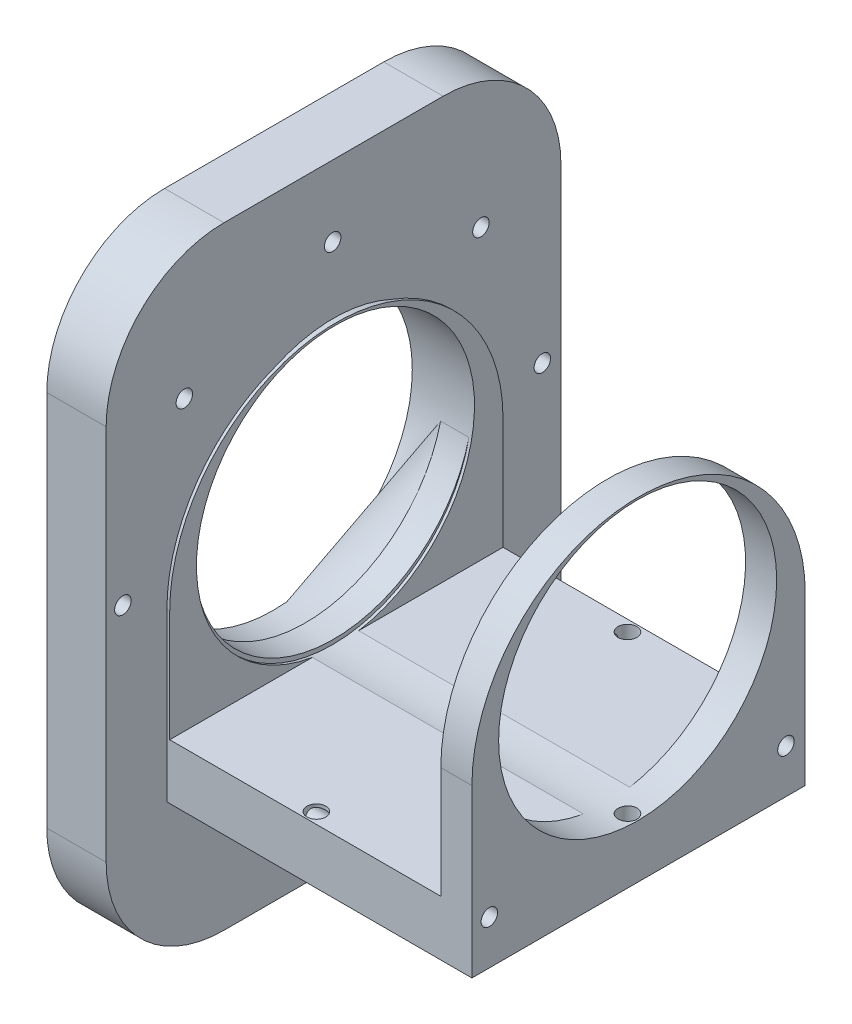
from build123d import *

# Parameters (mm, degrees)
SKETCH_1_W               = 70.72
SKETCH_1_H               = 70.72
EXTRUDE_1_DEPTH          = 70.72
CUT_EXTRUDE_2_DEPTH      = 125.72
CUT_EXTRUDE_2_DEPTH_BACK = 26
SKETCH_2_W               = 57.52
SKETCH_2_H               = 59
FILLET_1_RADIUS          = 35.36
FILLET_1_LENGTH          = 6.6
FILLET_2_RADIUS          = 35.36
FILLET_2_LENGTH          = 6.6
CUT_EXTRUDE_4_DEPTH      = 1
CUT_EXTRUDE_4_DEPTH_BACK = 267
SKETCH_3_R               = 29.5
SKETCH_8_R               = 3
EXTRUDE_2_DEPTH          = 6
SKETCH_11_R              = 1.75
CUT_EXTRUDE_5_DEPTH      = 88
SKETCH_14_W              = 96.5
SKETCH_14_H              = 130.02
EXTRUDE_3_DEPTH          = 6.6
SKETCH_21_R              = 29.5
CUT_EXTRUDE_7_DEPTH      = 51
CUT_EXTRUDE_START        = -10
SKETCH_24_R              = 1.75
CUT_EXTRUDE_8_DEPTH      = 10
EXTRUDE_4_OUTLINE_W      = 96.5
EXTRUDE_4_OUTLINE_H      = 130.02
EXTRUDE_4_DEPTH          = 6
CUT_EXTRUDE_START_2      = 32
SKETCH_27_R              = 1.75
CUT_EXTRUDE_13_DEPTH     = 32
CUT_EXTRUDE_15_REACH     = 139.206
SKETCH_29_R              = 2
FILLET_3_R               = 25
FILLET_4_R               = 25
FILLET_5_R               = 25
FILLET_6_R               = 25


# Read off the part's stored shape, not the designer's step: 凸台-拉伸4
with BuildPart() as part:
    # 草图1 → 凸台-拉伸1 (new body)
    with BuildSketch(Plane.XY):
        Rectangle(SKETCH_1_W, SKETCH_1_H)
    extrude(amount=EXTRUDE_1_DEPTH)

    # 草图2 → 切除-拉伸2 (cut, two sides: drawn at the far end of the back side and taken through both)
    with BuildSketch(Plane.XY.offset(-CUT_EXTRUDE_2_DEPTH_BACK)):
        with Locations((0, 5.86)):
            Rectangle(SKETCH_2_W, SKETCH_2_H)
    extrude(amount=CUT_EXTRUDE_2_DEPTH + CUT_EXTRUDE_2_DEPTH_BACK, mode=Mode.SUBTRACT)

    # 圆角1: full round fillet: the end face becomes a half cylinder, R = half its width
    fillet_1_face = Plane((-32.06, 35.36, 35.36), x_dir=(-1, 0, 0), z_dir=(0, 1, 0))  # on the end face: x along it, z out of the body
    fillet_1_slab = fillet_1_face.offset(-FILLET_1_RADIUS / 2) * Box(FILLET_1_LENGTH, 2 * FILLET_1_RADIUS, FILLET_1_RADIUS, mode=Mode.PRIVATE)  # the body's end, R deep
    fillet_1_round = Plane((-32.06, 0, 35.36), x_dir=(0, 1, 0), z_dir=(-1, 0, 0)) * Cylinder(FILLET_1_RADIUS, FILLET_1_LENGTH, mode=Mode.PRIVATE)  # its axis R under the face
    add(fillet_1_slab - fillet_1_round, mode=Mode.SUBTRACT)

    # 圆角2: full round fillet: the end face becomes a half cylinder, R = half its width
    fillet_2_face = Plane((32.06, 35.36, 35.36), x_dir=(-1, 0, 0), z_dir=(0, 1, 0))  # on the end face: x along it, z out of the body
    fillet_2_slab = fillet_2_face.offset(-FILLET_2_RADIUS / 2) * Box(FILLET_2_LENGTH, 2 * FILLET_2_RADIUS, FILLET_2_RADIUS, mode=Mode.PRIVATE)  # the body's end, R deep
    fillet_2_round = Plane((32.06, 0, 35.36), x_dir=(0, 1, 0), z_dir=(-1, 0, 0)) * Cylinder(FILLET_2_RADIUS, FILLET_2_LENGTH, mode=Mode.PRIVATE)  # its axis R under the face
    add(fillet_2_slab - fillet_2_round, mode=Mode.SUBTRACT)

    # 草图3 → 切除-拉伸4 (cut, two sides: drawn at the far end of the back side and taken through both)
    with BuildSketch(Plane(origin=(35.36, 0, 0), x_dir=(0, 0, -1), z_dir=(1, 0, 0)).offset(-CUT_EXTRUDE_4_DEPTH_BACK)):
        with Locations(Location((-35.555066, 5.448484, 0), (0, 0, 90))):
            Circle(SKETCH_3_R)
    extrude(amount=CUT_EXTRUDE_4_DEPTH + CUT_EXTRUDE_4_DEPTH_BACK, mode=Mode.SUBTRACT)

    # 草图8 → 凸台-拉伸2 (add)
    with BuildSketch(Plane.XZ.offset(35.36)):
        with Locations(Location((0, 35.36, 0), (0, 0, 90))):
            Circle(SKETCH_8_R)
    extrude(amount=EXTRUDE_2_DEPTH)

    # 草图11 → 切除-拉伸5 (cut)
    with BuildSketch(Plane(origin=(35.36, 0, 0), x_dir=(0, 0, -1), z_dir=(1, 0, 0))):
        with Locations((-35.555066, -39.051516)):
            Circle(SKETCH_11_R)
        with Locations((-67.021318, -26.017768)):
            Circle(SKETCH_11_R)
        with Locations((-80.055066, 5.448484)):
            Circle(SKETCH_11_R)
        with Locations((-67.021318, 36.914736)):
            Circle(SKETCH_11_R)
        with Locations((-35.555066, 49.948484)):
            Circle(SKETCH_11_R)
        with Locations((-4.088814, 36.914736)):
            Circle(SKETCH_11_R)
        with Locations((8.944934, 5.448484)):
            Circle(SKETCH_11_R)
        with Locations((-4.088814, -26.017768)):
            Circle(SKETCH_11_R)
    extrude(amount=-CUT_EXTRUDE_5_DEPTH, mode=Mode.SUBTRACT)

    # 草图14 → 凸台-拉伸3 (add)
    with BuildSketch(Plane.ZY.offset(35.36)):
        with Locations((35.36, 0)):
            Rectangle(SKETCH_14_W, SKETCH_14_H)
    extrude(amount=EXTRUDE_3_DEPTH)

    # 草图21 → 切除-拉伸7 (cut)
    with BuildSketch(Plane(origin=(-35.36, 0, 0), x_dir=(0, 0, -1), z_dir=(1, 0, 0))):
        with Locations(Location((-35.555066, 5.448484, 0), (0, 0, 270))):
            Circle(SKETCH_21_R)
    extrude(amount=-CUT_EXTRUDE_7_DEPTH, mode=Mode.SUBTRACT)

    # 草图24 → 切除-拉伸8 (cut)
    with BuildSketch(Plane.ZY.offset(41.96).offset(CUT_EXTRUDE_START)):
        with Locations(Location((35.555066, 49.948484, 0), (0, 0, 270))):
            Circle(SKETCH_24_R)
        with Locations(Location((67.021318, 36.914736, 0), (0, 0, 270))):
            Circle(SKETCH_24_R)
        with Locations(Location((80.055066, 5.448484, 0), (0, 0, 270))):
            Circle(SKETCH_24_R)
        with Locations(Location((67.021318, -26.017768, 0), (0, 0, 180))):
            Circle(SKETCH_24_R)
        with Locations(Location((35.555066, -39.051516, 0), (0, 0, 180))):
            Circle(SKETCH_24_R)
        with Locations(Location((4.088814, -26.017768, 0), (0, 0, 180))):
            Circle(SKETCH_24_R)
        with Locations(Location((-8.944934, 5.448484, 0), (0, 0, 270))):
            Circle(SKETCH_24_R)
        with Locations(Location((4.088814, 36.914736, 0), (0, 0, 270))):
            Circle(SKETCH_24_R)
    extrude(amount=CUT_EXTRUDE_8_DEPTH, mode=Mode.SUBTRACT)

    # 凸台-拉伸4 outline → 凸台-拉伸4 (add)
    with BuildSketch(Plane(origin=(-35.36, 0, 0), x_dir=(0, 0, -1), z_dir=(1, 0, 0))):
        with Locations((-35.36, 0)):
            Rectangle(EXTRUDE_4_OUTLINE_W, EXTRUDE_4_OUTLINE_H)
        with BuildLine():
            ThreePointArc((-6.646022, -0.426647), (-41.68053, -22.477164), (-64.269044, 12.212909))
            ThreePointArc((-64.269044, 12.212909), (-29.234536, 34.263426), (-6.646022, -0.426647))
        make_face(mode=Mode.SUBTRACT)
        with BuildLine():
            ThreePointArc((-23.066375, 33.154131), (-35.36, 35.36), (-47.653625, 33.154131))
            ThreePointArc((-47.653625, 33.154131), (-35.36, 35.837778), (-23.066375, 33.154131))
        make_face(mode=Mode.SUBTRACT)
    extrude(amount=EXTRUDE_4_DEPTH)

    # 草图27 → 切除-拉伸13 (cut)
    with BuildSketch(Plane(origin=(-35.36, 0, 0), x_dir=(0, 0, -1), z_dir=(1, 0, 0)).offset(CUT_EXTRUDE_START_2)):
        with Locations(Location((-35.555066, 49.948484, 0), (0, 0, 270))):
            Circle(SKETCH_27_R)
        with Locations(Location((-4.088814, 36.914736, 0), (0, 0, 270))):
            Circle(SKETCH_27_R)
        with Locations(Location((8.944934, 5.448484, 0), (0, 0, 270))):
            Circle(SKETCH_27_R)
        with Locations((-4.088814, -26.017768)):
            Circle(SKETCH_27_R)
        with Locations((-35.555066, -39.051516)):
            Circle(SKETCH_27_R)
        with Locations((-67.021318, -26.017768)):
            Circle(SKETCH_27_R)
        with Locations(Location((-80.055066, 5.448484, 0), (0, 0, 270))):
            Circle(SKETCH_27_R)
        with Locations(Location((-67.021318, 36.914736, 0), (0, 0, 270))):
            Circle(SKETCH_27_R)
    extrude(amount=-CUT_EXTRUDE_13_DEPTH, mode=Mode.SUBTRACT)

    # 切除-拉伸15: up to this face of the body (flat: up to its plane)
    cut_extrude_15_end = Plane(part.part.faces().sort_by_distance((0, -23.64, 15.322431))[0])
    # 草图29 → 切除-拉伸15 (cut, up to the picked face)
    with BuildSketch(Plane(origin=(0, -35.36, 0), x_dir=(-1, 0, 0), z_dir=(0, -1, 0)), mode=Mode.PRIVATE) as cut_extrude_15_sk1:
        with Locations(Location((0, -68.36, 0), (0, 0, 90))):
            Circle(SKETCH_29_R)
    cut_extrude_15_tool1 = split(extrude(cut_extrude_15_sk1.sketch, amount=-CUT_EXTRUDE_15_REACH, mode=Mode.PRIVATE), bisect_by=cut_extrude_15_end, keep=Keep.BOTH, mode=Mode.PRIVATE)
    # 草图29 → 切除-拉伸15 (cut, up to the picked face)
    with BuildSketch(Plane(origin=(0, -35.36, 0), x_dir=(-1, 0, 0), z_dir=(0, -1, 0)), mode=Mode.PRIVATE) as cut_extrude_15_sk2:
        with Locations(Location((-33, -35.36, 0), (0, 0, 90))):
            Circle(SKETCH_29_R)
    cut_extrude_15_tool2 = split(extrude(cut_extrude_15_sk2.sketch, amount=-CUT_EXTRUDE_15_REACH, mode=Mode.PRIVATE), bisect_by=cut_extrude_15_end, keep=Keep.BOTH, mode=Mode.PRIVATE)
    # 草图29 → 切除-拉伸15 (cut, up to the picked face)
    with BuildSketch(Plane(origin=(0, -35.36, 0), x_dir=(-1, 0, 0), z_dir=(0, -1, 0)), mode=Mode.PRIVATE) as cut_extrude_15_sk3:
        with Locations(Location((0, -2.36, 0), (0, 0, 90))):
            Circle(SKETCH_29_R)
    cut_extrude_15_tool3 = split(extrude(cut_extrude_15_sk3.sketch, amount=-CUT_EXTRUDE_15_REACH, mode=Mode.PRIVATE), bisect_by=cut_extrude_15_end, keep=Keep.BOTH, mode=Mode.PRIVATE)
    add(cut_extrude_15_tool1.solids().sort_by(Axis((0, -35.36, 68.36), (0, 1, 0)))[0], mode=Mode.SUBTRACT)
    add(cut_extrude_15_tool2.solids().sort_by(Axis((33, -35.36, 35.36), (0, 1, 0)))[0], mode=Mode.SUBTRACT)
    add(cut_extrude_15_tool3.solids().sort_by(Axis((0, -35.36, 2.36), (0, 1, 0)))[0], mode=Mode.SUBTRACT)

    # 圆角3
    fillet_3_edges = [part.edges().sort_by_distance(p)[0] for p in [
        (-35.66, 65.01, -12.89),
    ]]
    fillet(fillet_3_edges, radius=FILLET_3_R)

    # 圆角4
    fillet_4_edges = [part.edges().sort_by_distance(p)[0] for p in [
        (-35.66, 65.01, 83.61),
    ]]
    fillet(fillet_4_edges, radius=FILLET_4_R)

    # 圆角5
    fillet_5_edges = [part.edges().sort_by_distance(p)[0] for p in [
        (-35.66, -65.01, -12.89),
    ]]
    fillet(fillet_5_edges, radius=FILLET_5_R)

    # 圆角6
    fillet_6_edges = [part.edges().sort_by_distance(p)[0] for p in [
        (-35.66, -65.01, 83.61),
    ]]
    fillet(fillet_6_edges, radius=FILLET_6_R)


solid = part.part
